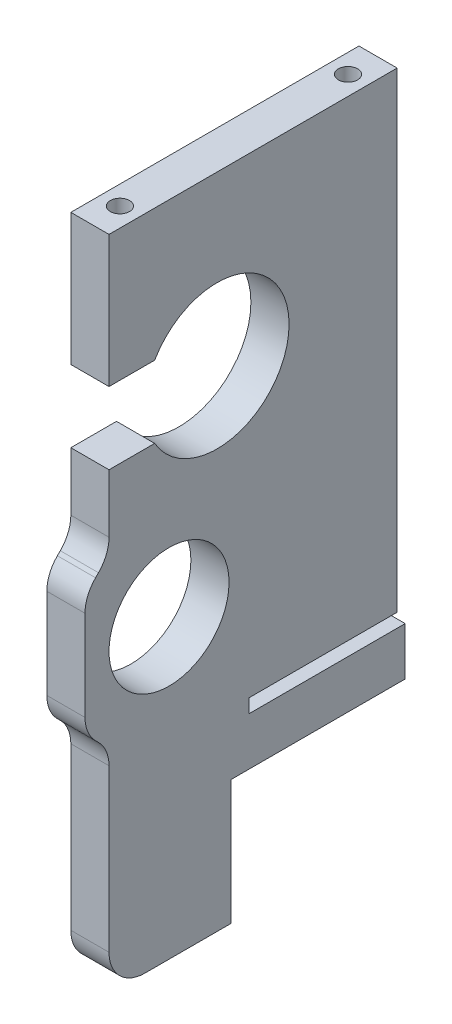
from build123d import *

# Parameters (mm, degrees)
BOSS_EXTRUDE1_DEPTH       = 3.18
SKETCH2_4_OUTSIDE_W       = 40.874
SKETCH2_4_OUTSIDE_H       = 68.994
SKETCH2_4_OUTSIDE_R       = 5
CUT_EXTRUDE2_DEPTH        = 3.18
FILLET6_R                 = 3
M2X0_4_TAPPED_HOLE1_D     = 1.6
M2X0_4_TAPPED_HOLE1_DEPTH = 5.519311505
M2X0_4_TAPPED_HOLE1_TIP   = 0.480688495


with BuildPart() as part:
    # Sketch2 → Boss-Extrude1 (new body)
    with BuildSketch(Plane(origin=(0, 0, 0), x_dir=(0, 0, -1), z_dir=(1, 0, 0))):
        with BuildLine():
            Line((0, 54.79), (24, 54.79))
            Line((24, 54.79), (24, 15.53))
            Line((24, 15.53), (11.67, 15.53))
            Line((11.67, 15.53), (11.67, 14.38))
            Line((11.67, 14.38), (24.67, 14.38))
            Line((24.67, 14.38), (24.67, 10.38))
            Line((24.67, 10.38), (10.17, 10.38))
            Line((10.17, 10.38), (10.17, 0))
            Line((10.17, 0), (0, 0))
            Line((0, 0), (0, 17.7))
            Line((0, 17.7), (-2, 19.7))
            Line((-2, 19.7), (-2, 29.7))
            Line((-2, 29.7), (0, 31.7))
            Line((0, 31.7), (0, 37.810865899))
            Line((0, 37.810865899), (3.803847577, 37.810865899))
            ThreePointArc((3.803847577, 37.810865899), (15, 40.810865899), (3.803847577, 43.810865899))
            Line((3.803847577, 43.810865899), (0, 43.810865899))
            Line((0, 43.810865899), (0, 54.79))
        make_face()
    extrude(amount=-BOSS_EXTRUDE1_DEPTH)

    # Sketch2<4> outside → Cut-Extrude2 (cut)
    # profile 1 of 2: a face of its own
    with BuildSketch(Plane(origin=(0, 0, 0), x_dir=(0, 0, -1), z_dir=(1, 0, 0))):
        with Locations((11.335, 27.395)):
            Rectangle(SKETCH2_4_OUTSIDE_W, SKETCH2_4_OUTSIDE_H)
        with BuildLine():
            Line((0, 54.79), (24, 54.79))
            Line((24, 54.79), (24, 15.53))
            Line((24, 15.53), (11.67, 15.53))
            Line((11.67, 15.53), (11.67, 14.38))
            Line((11.67, 14.38), (24.67, 14.38))
            Line((24.67, 14.38), (24.67, 10.38))
            Line((24.67, 10.38), (10.17, 10.38))
            Line((10.17, 10.38), (10.17, 0))
            Line((10.17, 0), (0, 0))
            Line((0, 0), (0, 17.7))
            Line((0, 17.7), (-2, 19.7))
            Line((-2, 19.7), (-2, 29.7))
            Line((-2, 29.7), (0, 31.7))
            Line((0, 31.7), (0, 37.810865899))
            Line((0, 37.810865899), (3.803847577, 37.810865899))
            ThreePointArc((3.803847577, 37.810865899), (15, 40.810865899), (3.803847577, 43.810865899))
            Line((3.803847577, 43.810865899), (0, 43.810865899))
            Line((0, 43.810865899), (0, 54.79))
        make_face(mode=Mode.SUBTRACT)
    # profile 2 of 2: a face of its own
    with BuildSketch(Plane(origin=(0, 0, 0), x_dir=(0, 0, -1), z_dir=(1, 0, 0))):
        with Locations((5, 24.7)):
            Circle(SKETCH2_4_OUTSIDE_R)
    extrude(amount=-CUT_EXTRUDE2_DEPTH, mode=Mode.SUBTRACT)

    # Fillet6
    fillet6_edges = [part.edges().sort_by_distance(p)[0] for p in [
        (-1.59, 17.7, 0),
        (-1.59, 19.7, 2),
        (-1.59, 29.7, 2),
        (-1.59, 31.7, 0),
        (-1.59, 0, 0),
    ]]
    fillet(fillet6_edges, radius=FILLET6_R)

    # M2x0.4 Tapped Hole1
    with Locations(Plane(origin=(0, 54.79, 0), x_dir=(1, 0, 0), z_dir=(0, 1, 0))):
        with Locations((-1.59, 21.5), (-1.59, 2.5)):
            Hole(M2X0_4_TAPPED_HOLE1_D / 2, depth=M2X0_4_TAPPED_HOLE1_DEPTH)
            with Locations((0, 0, -(M2X0_4_TAPPED_HOLE1_DEPTH + M2X0_4_TAPPED_HOLE1_TIP / 2))):  # 118° drill point
                Cone(0, M2X0_4_TAPPED_HOLE1_D / 2, M2X0_4_TAPPED_HOLE1_TIP, mode=Mode.SUBTRACT)


with BuildPart() as body_2:
    # Mirror1: mirrored copy
    add(part.part.mirror(Plane(origin=(0, 40.810865899, -9), x_dir=(0, 0, 1), z_dir=(1, 0, 0))))


solid = body_2.part
